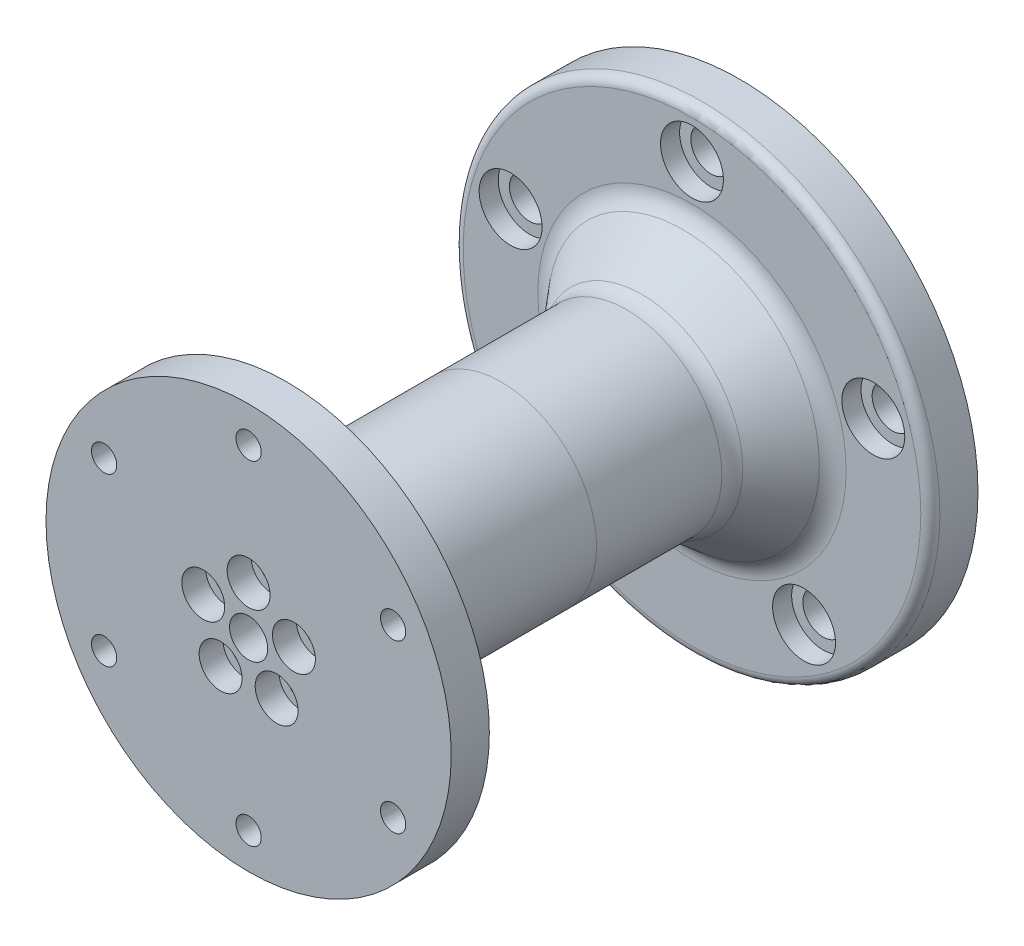
from build123d import *
from build123d.topology import SkipClean

# Parameters (mm, degrees)
SKETCH1_R           = 50
SKETCH1_R_2         = 4.25
BOSS_EXTRUDE1_DEPTH = 10
SKETCH2_R           = 6.6
CUT_EXTRUDE1_DEPTH  = 4
SKETCH3_R           = 20
BOSS_EXTRUDE2_DEPTH = 40
CHAMFER1_SIZE       = 10
CHAMFER1_SIZE2      = 11.917535926
FILLET2_R           = 5
FILLET3_R           = 2
CUT_EXTRUDE3_DEPTH  = 10
SKETCH13_R          = 3.1
CUT_EXTRUDE8_DEPTH  = 8
SKETCH8_R           = 4
CUT_EXTRUDE5_DEPTH  = 87.602540436
SKETCH9_R           = 6.5
CUT_EXTRUDE6_DEPTH  = 22
SKETCH19_R          = 12.5
CUT_EXTRUDE12_DEPTH = 6
SKETCH10_R          = 2.1
CUT_EXTRUDE13_DEPTH = 6
SKETCH11_R          = 20
SKETCH11_R_2        = 4
BOSS_EXTRUDE4_DEPTH = 45
BOSS_EXTRUDE5_START = 10
SKETCH14_R          = 4
BOSS_EXTRUDE5_DEPTH = 10
CHAMFER2_SIZE       = 1
CHAMFER3_SIZE       = 1
SKETCH15_R          = 42.5
SKETCH15_R_2        = 4
SKETCH15_R_3        = 2.65
BOSS_EXTRUDE6_DEPTH = 8
FILLET4_R           = 3
FILLET5_R           = 3
SKETCH16_R          = 2.65
CUT_EXTRUDE9_DEPTH  = 125.935983608
SKETCH17_R          = 4.5
CUT_EXTRUDE10_DEPTH = 5
FILLET6_R           = 10
CUT_EXTRUDE11_DEPTH = 4


with BuildPart() as part:
    # Sketch1 → Boss-Extrude1 (new body)
    with BuildSketch(Plane.XY):
        Circle(SKETCH1_R)
        with Locations((0, 40)):
            Circle(SKETCH1_R_2, mode=Mode.SUBTRACT)
        with Locations((38.042260652, 12.360679775)):
            Circle(SKETCH1_R_2, mode=Mode.SUBTRACT)
        with Locations((23.511410092, -32.360679775)):
            Circle(SKETCH1_R_2, mode=Mode.SUBTRACT)
        with Locations((-23.511410092, -32.360679775)):
            Circle(SKETCH1_R_2, mode=Mode.SUBTRACT)
        with Locations((-38.042260652, 12.360679775)):
            Circle(SKETCH1_R_2, mode=Mode.SUBTRACT)
    extrude(amount=BOSS_EXTRUDE1_DEPTH)

    # Sketch2 → Cut-Extrude1 (cut)
    with BuildSketch(Plane.XY.offset(10)):
        with Locations((-38.042260652, 12.360679775)):
            Circle(SKETCH2_R)
        with Locations((0, 40)):
            Circle(SKETCH2_R)
        with Locations((38.042260652, 12.360679775)):
            Circle(SKETCH2_R)
        with Locations((23.511410092, -32.360679775)):
            Circle(SKETCH2_R)
        with Locations((-23.511410092, -32.360679775)):
            Circle(SKETCH2_R)
    extrude(amount=-CUT_EXTRUDE1_DEPTH, mode=Mode.SUBTRACT)

    # Sketch3 → Boss-Extrude2 (add)
    with BuildSketch(Plane.XY.offset(10)):
        Circle(SKETCH3_R)
    extrude(amount=BOSS_EXTRUDE2_DEPTH)

    # Chamfer1
    chamfer1_edges = [part.edges().sort_by_distance(p)[0] for p in [
        (-20, 0, 10),
    ]]
    chamfer1_side = [part.faces().sort_by_distance(p)[0] for p in [
        (-48.585786438, 0, 10),
    ]]
    chamfer(chamfer1_edges, length=CHAMFER1_SIZE, length2=CHAMFER1_SIZE2, reference=chamfer1_side[0])

    # Fillet2
    fillet2_edges = [part.edges().sort_by_distance(p)[0] for p in [
        (-30, 0, 10),
        (-20, 0, 21.917535926),
    ]]
    fillet(fillet2_edges, radius=FILLET2_R)

    # Fillet3
    fillet3_edges = [part.edges().sort_by_distance(p)[0] for p in [
        (-50, 0, 10),
    ]]
    fillet(fillet3_edges, radius=FILLET3_R)

    # Sketch5 → Cut-Extrude3 (cut)
    with BuildSketch(Plane.XY.offset(50)):
        with BuildLine():
            ThreePointArc((14.715876705, -2.309342234), (13.430801818, -4.363932047), (13.262791649, -6.781478189))
            ThreePointArc((13.262791649, -6.781478189), (10.286241915, -14.157797402), (2.351141009, -14.709256429))
            ThreePointArc((2.351141009, -14.709256429), (0, -14.121980752), (-2.351141009, -14.709256429))
            ThreePointArc((-2.351141009, -14.709256429), (-10.286241915, -14.157797402), (-13.262791649, -6.781478189))
            ThreePointArc((-13.262791649, -6.781478189), (-13.430801818, -4.363932047), (-14.715876705, -2.309342234))
            ThreePointArc((-14.715876705, -2.309342234), (-16.643489035, 5.407797402), (-10.547997034, 10.518072414))
            ThreePointArc((-10.547997034, 10.518072414), (-8.300692019, 11.424922423), (-6.743770969, 13.282004437))
            ThreePointArc((-6.743770969, 13.282004437), (0, 17.5), (6.743770969, 13.282004437))
            ThreePointArc((6.743770969, 13.282004437), (8.300692019, 11.424922423), (10.547997034, 10.518072414))
            ThreePointArc((10.547997034, 10.518072414), (16.643489035, 5.407797402), (14.715876705, -2.309342234))
        make_face()
    extrude(amount=-CUT_EXTRUDE3_DEPTH, mode=Mode.SUBTRACT)

    # Sketch13 → Cut-Extrude8 (cut)
    with BuildSketch(Plane.XY.offset(40)):
        with Locations((0, 10)):
            Circle(SKETCH13_R)
        with Locations((9.510565163, 3.090169944)):
            Circle(SKETCH13_R)
        with Locations((5.877852523, -8.090169944)):
            Circle(SKETCH13_R)
        with Locations((-5.877852523, -8.090169944)):
            Circle(SKETCH13_R)
        with Locations((-9.510565163, 3.090169944)):
            Circle(SKETCH13_R)
    extrude(amount=-CUT_EXTRUDE8_DEPTH, mode=Mode.SUBTRACT)

    # Sketch8 → Cut-Extrude5 (cut, through all)
    with BuildSketch(Plane(origin=(0, 0, 0), x_dir=(-1, 0, 0), z_dir=(0, 0, -1))):
        Circle(SKETCH8_R)
    extrude(amount=-CUT_EXTRUDE5_DEPTH, mode=Mode.SUBTRACT)

    # Sketch9 → Cut-Extrude6 (cut)
    with BuildSketch(Plane(origin=(0, 0, 0), x_dir=(-1, 0, 0), z_dir=(0, 0, -1))):
        Circle(SKETCH9_R)
    extrude(amount=-CUT_EXTRUDE6_DEPTH, mode=Mode.SUBTRACT)

    # Sketch19 → Cut-Extrude12 (cut)
    with BuildSketch(Plane(origin=(0, 0, 0), x_dir=(-1, 0, 0), z_dir=(0, 0, -1))):
        Circle(SKETCH19_R)
    extrude(amount=-CUT_EXTRUDE12_DEPTH, mode=Mode.SUBTRACT)

    # Sketch10 → Cut-Extrude13 (cut)
    with BuildSketch(Plane(origin=(0, 0, 6), x_dir=(-1, 0, 0), z_dir=(0, 0, -1))):
        with Locations((0, 9)):
            Circle(SKETCH10_R)
        with Locations((7.794228634, -4.5)):
            Circle(SKETCH10_R)
        with Locations((-7.794228634, -4.5)):
            Circle(SKETCH10_R)
    extrude(amount=-CUT_EXTRUDE13_DEPTH, mode=Mode.SUBTRACT)

    # Chamfer3
    chamfer3_edges = [part.edges().sort_by_distance(p)[0] for p in [
        (13.430801818, -4.363932047, 50),
        (16.643489035, 5.407797402, 50),
        (10.286241915, -14.157797402, 50),
        (8.300692019, 11.424922423, 50),
        (0, -14.121980752, 50),
        (0, 17.5, 50),
        (-10.286241915, -14.157797402, 50),
        (-8.300692019, 11.424922423, 50),
        (-13.430801818, -4.363932047, 50),
        (-16.643489035, 5.407797402, 50),
    ]]
    chamfer(chamfer3_edges, length=CHAMFER3_SIZE)

    # Fillet4
    fillet4_edges = [part.edges().sort_by_distance(p)[0] for p in [
        (8.300692019, 11.424922423, 40),
        (16.643489035, 5.407797402, 40),
        (13.430801818, -4.363932047, 40),
        (10.286241915, -14.157797402, 40),
        (0, -14.121980752, 40),
        (-10.286241915, -14.157797402, 40),
        (-13.430801818, -4.363932047, 40),
        (-16.643489035, 5.407797402, 40),
        (-8.300692019, 11.424922423, 40),
        (0, 17.5, 40),
    ]]
    fillet(fillet4_edges, radius=FILLET4_R)


with BuildPart() as body_2:
    # Sketch11 → Boss-Extrude4 (new body)
    with BuildSketch(Plane.XY.offset(50)):
        Circle(SKETCH11_R)
        Circle(SKETCH11_R_2, mode=Mode.SUBTRACT)
    extrude(amount=BOSS_EXTRUDE4_DEPTH)

    # Sketch14 → Boss-Extrude5 (add)
    with SkipClean():  # the faces are left unmerged after this step: merging them gives an invalid solid
        with BuildSketch(Plane(origin=(0, 0, 50), x_dir=(-1, 0, 0), z_dir=(0, 0, -1)).offset(BOSS_EXTRUDE5_START)):
            with BuildLine():
                ThreePointArc((-10.506499759, 10.220956316), (-16.35817208, 5.315092303), (-14.507664243, -2.093361747))
                ThreePointArc((-14.507664243, -2.093361747), (-13.145484863, -4.271226948), (-12.967394084, -6.833825859))
                ThreePointArc((-12.967394084, -6.833825859), (-10.109906339, -13.915092303), (-2.49220947, -14.44449297))
                ThreePointArc((-2.49220947, -14.44449297), (0, -13.821980752), (2.49220947, -14.44449297))
                ThreePointArc((2.49220947, -14.44449297), (10.109906339, -13.915092303), (12.967394084, -6.833825859))
                ThreePointArc((12.967394084, -6.833825859), (13.145484863, -4.271226948), (14.507664243, -2.093361747))
                ThreePointArc((14.507664243, -2.093361747), (16.35817208, 5.315092303), (10.506499759, 10.220956316))
                ThreePointArc((10.506499759, 10.220956316), (8.124356444, 11.182217325), (6.47402013, 13.150724259))
                ThreePointArc((6.47402013, 13.150724259), (0, 17.2), (-6.47402013, 13.150724259))
                ThreePointArc((-6.47402013, 13.150724259), (-8.124356444, 11.182217325), (-10.506499759, 10.220956316))
            make_face()
            Circle(SKETCH14_R, mode=Mode.SUBTRACT)
        extrude(amount=-BOSS_EXTRUDE5_DEPTH)

    # Chamfer2
    chamfer2_edges = [body_2.edges().sort_by_distance(p)[0] for p in [
        (13.145484863, -4.271226948, 50),
        (10.109906339, -13.915092303, 50),
        (16.35817208, 5.315092303, 50),
        (0, -13.821980752, 50),
        (8.124356444, 11.182217325, 50),
        (-10.109906339, -13.915092303, 50),
        (0, 17.2, 50),
        (-13.145484863, -4.271226948, 50),
        (-8.124356444, 11.182217325, 50),
        (-16.35817208, 5.315092303, 50),
    ]]
    chamfer(chamfer2_edges, length=CHAMFER2_SIZE)

    # Sketch15 → Boss-Extrude6 (add)
    with BuildSketch(Plane.XY.offset(95)):
        Circle(SKETCH15_R)
        Circle(SKETCH15_R_2, mode=Mode.SUBTRACT)
        with Locations((0, 35)):
            Circle(SKETCH15_R_3, mode=Mode.SUBTRACT)
        with Locations((30.310889132, 17.5)):
            Circle(SKETCH15_R_3, mode=Mode.SUBTRACT)
        with Locations((30.310889132, -17.5)):
            Circle(SKETCH15_R_3, mode=Mode.SUBTRACT)
        with Locations((0, -35)):
            Circle(SKETCH15_R_3, mode=Mode.SUBTRACT)
        with Locations((-30.310889132, -17.5)):
            Circle(SKETCH15_R_3, mode=Mode.SUBTRACT)
        with Locations((-30.310889132, 17.5)):
            Circle(SKETCH15_R_3, mode=Mode.SUBTRACT)
    extrude(amount=BOSS_EXTRUDE6_DEPTH)

    # Fillet5
    fillet5_edges = [body_2.edges().sort_by_distance(p)[0] for p in [
        (-13.145484863, -4.271226948, 40),
        (-10.109906339, -13.915092303, 40),
        (0, -13.821980752, 40),
        (10.109906339, -13.915092303, 40),
        (13.145484863, -4.271226948, 40),
        (16.35817208, 5.315092303, 40),
        (8.124356444, 11.182217325, 40),
        (0, 17.2, 40),
        (-8.124356444, 11.182217325, 40),
        (-16.35817208, 5.315092303, 40),
    ]]
    fillet(fillet5_edges, radius=FILLET5_R)

    # Sketch16 → Cut-Extrude9 (cut, through all)
    with BuildSketch(Plane.XY.offset(103)):
        with Locations((0, 10)):
            Circle(SKETCH16_R)
        with Locations((9.510565163, 3.090169944)):
            Circle(SKETCH16_R)
        with Locations((5.877852523, -8.090169944)):
            Circle(SKETCH16_R)
        with Locations((-5.877852523, -8.090169944)):
            Circle(SKETCH16_R)
        with Locations((-9.510565163, 3.090169944)):
            Circle(SKETCH16_R)
    extrude(amount=-CUT_EXTRUDE9_DEPTH, mode=Mode.SUBTRACT)

    # Sketch17 → Cut-Extrude10 (cut)
    with BuildSketch(Plane.XY.offset(103)):
        with Locations((0, 10)):
            Circle(SKETCH17_R)
        with Locations((9.510565163, 3.090169944)):
            Circle(SKETCH17_R)
        with Locations((5.877852523, -8.090169944)):
            Circle(SKETCH17_R)
        with Locations((-5.877852523, -8.090169944)):
            Circle(SKETCH17_R)
        with Locations((-9.510565163, 3.090169944)):
            Circle(SKETCH17_R)
    extrude(amount=-CUT_EXTRUDE10_DEPTH, mode=Mode.SUBTRACT)

    # Fillet6
    fillet6_edges = [body_2.edges().sort_by_distance(p)[0] for p in [
        (-20, 0, 95),
    ]]
    fillet(fillet6_edges, radius=FILLET6_R)

    # Sketch18 → Cut-Extrude11 (cut)
    with BuildSketch(Plane(origin=(0, 0, 95), x_dir=(-1, 0, 0), z_dir=(0, 0, -1))):
        Polygon((32.70689275, 21.65), (27.914885515, 21.65), (25.518881898, 17.5), (27.914885515, 13.35), (32.70689275, 13.35), (35.102896367, 17.5), align=None)
        Polygon((-2.396003617, 39.15), (-4.792007234, 35), (-2.396003617, 30.85), (2.396003617, 30.85), (4.792007234, 35), (2.396003617, 39.15), align=None)
        Polygon((35.102896367, -17.5), (32.70689275, -13.35), (27.914885515, -13.35), (25.518881898, -17.5), (27.914885515, -21.65), (32.70689275, -21.65), align=None)
        Polygon((2.396003617, -39.15), (4.792007234, -35), (2.396003617, -30.85), (-2.396003617, -30.85), (-4.792007234, -35), (-2.396003617, -39.15), align=None)
        Polygon((-32.70689275, -21.65), (-27.914885515, -21.65), (-25.518881898, -17.5), (-27.914885515, -13.35), (-32.70689275, -13.35), (-35.102896367, -17.5), align=None)
        Polygon((-35.102896367, 17.5), (-32.70689275, 13.35), (-27.914885515, 13.35), (-25.518881898, 17.5), (-27.914885515, 21.65), (-32.70689275, 21.65), align=None)
    extrude(amount=-CUT_EXTRUDE11_DEPTH, mode=Mode.SUBTRACT)


solid = Compound([part.part, body_2.part])
